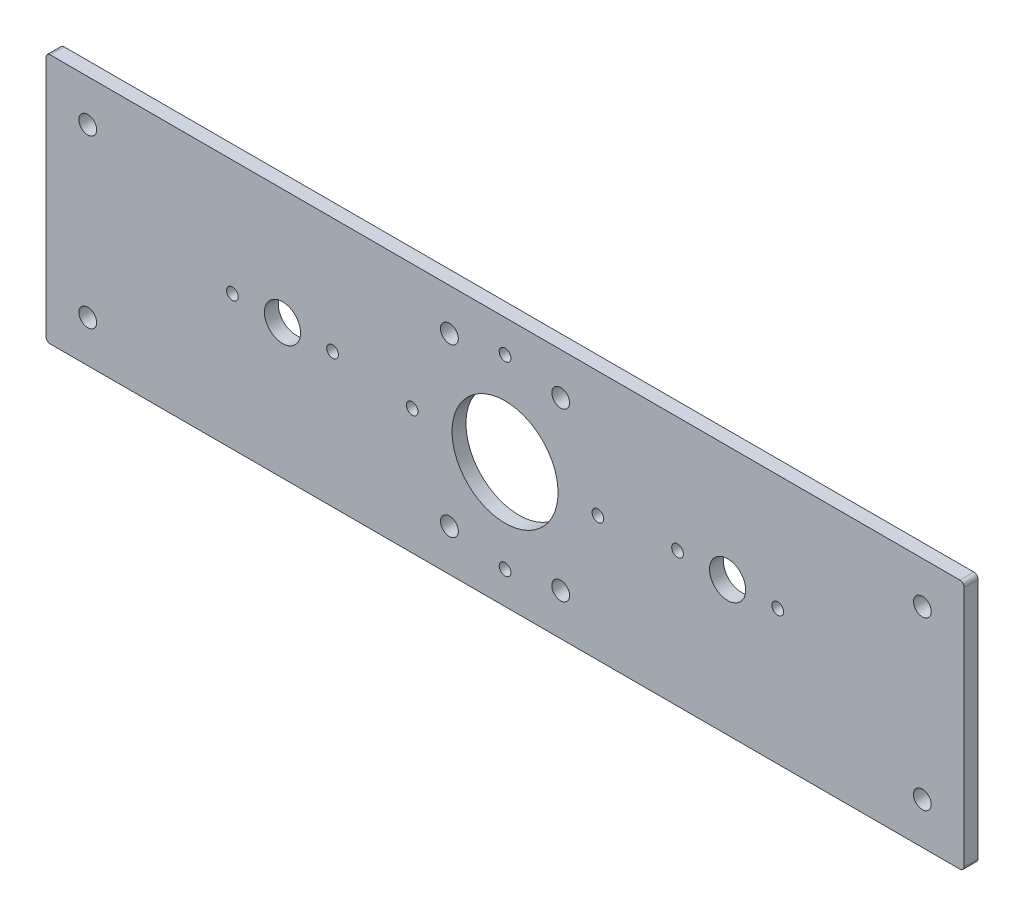
from build123d import *

# Parameters (mm, degrees)
SKETCH1_W             = 330
SKETCH1_H             = 90
SKETCH1_R             = 19.05
BOSS_EXTRUDE1_DEPTH   = 2.5
M6_CLEARANCE_HOLE1_D  = 6.4
SKETCH3_R             = 6.5
CUT_EXTRUDE2_DEPTH    = 172.099386323
M5X0_8_TAPPED_HOLE1_D = 4.2
M5X0_8_TAPPED_HOLE3_D = 4.2
FILLET1_R             = 1.5


with BuildPart() as part:
    # Sketch1 → Boss-Extrude1 (new, symmetric)
    with BuildSketch(Plane.XY):
        Rectangle(SKETCH1_W, SKETCH1_H)
        Circle(SKETCH1_R, mode=Mode.SUBTRACT)
    extrude(amount=BOSS_EXTRUDE1_DEPTH, both=True)

    # M6 Clearance Hole1 (through all)
    with Locations(Plane.XY.offset(2.5)):
        with Locations((-150, 30), (-20, 30), (-20, -30), (-150, -30)):
            m6_clearance_hole1 = Hole(M6_CLEARANCE_HOLE1_D / 2)

    # Mirror2: M6 Clearance Hole1 across plane
    add(m6_clearance_hole1.mirror(Plane(origin=(0, 0, 0), x_dir=(0, 0, 1), z_dir=(1, 0, 0))), mode=Mode.SUBTRACT)

    # Sketch3 → Cut-Extrude2 (cut, through all)
    with BuildSketch(Plane.XY.offset(2.5)):
        with Locations((-80, 3.4)):
            Circle(SKETCH3_R)
    cut_extrude2 = extrude(amount=-CUT_EXTRUDE2_DEPTH, mode=Mode.SUBTRACT)

    # M5x0.8 Tapped Hole1 (through all)
    with Locations(Plane.XY.offset(2.5)):
        with Locations((-98, 3.4), (-62, 3.4)):
            m5x0_8_tapped_hole1 = Hole(M5X0_8_TAPPED_HOLE1_D / 2)

    # Mirror1: Cut-Extrude2, M5x0.8 Tapped Hole1 across plane
    add(cut_extrude2.mirror(Plane(origin=(0, 0, 0), x_dir=(0, 0, 1), z_dir=(1, 0, 0))), mode=Mode.SUBTRACT)
    add(m5x0_8_tapped_hole1.mirror(Plane(origin=(0, 0, 0), x_dir=(0, 0, 1), z_dir=(1, 0, 0))), mode=Mode.SUBTRACT)

    # M5x0.8 Tapped Hole3 (through all)
    with Locations(Plane.XY.offset(2.5)):
        with Locations((0, 33.375440072), (0, -33.375440072), (-33.375440072, 0), (33.375440072, 0)):
            Hole(M5X0_8_TAPPED_HOLE3_D / 2)

    # Fillet1
    fillet1_edges = [part.edges().sort_by_distance(p)[0] for p in [
        (-165, -45, 0),
        (165, -45, 0),
        (165, 45, 0),
        (-165, 45, 0),
    ]]
    fillet(fillet1_edges, radius=FILLET1_R)


solid = part.part
